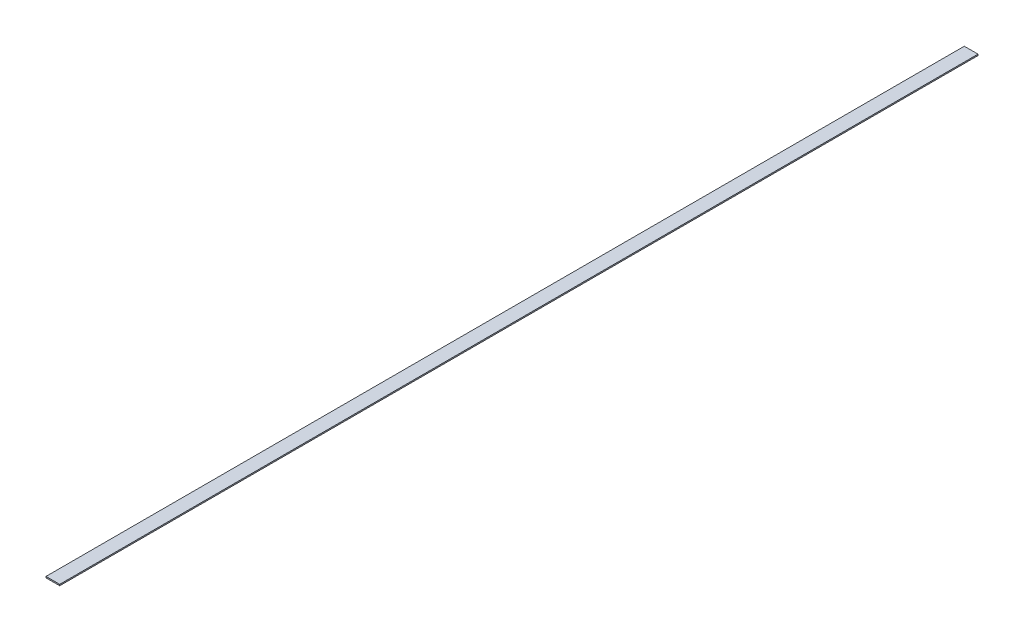
from build123d import *

# Parameters (mm, degrees)
SKETCH1_W           = 50.8
SKETCH1_H           = 4.7625
BOSS_EXTRUDE1_DEPTH = 3403.6


with BuildPart() as part:
    # Sketch1 → Boss-Extrude1 (new body)
    with BuildSketch(Plane.XY):
        with Locations((-19.015232349, 27.027852922)):
            Rectangle(SKETCH1_W, SKETCH1_H)
    extrude(amount=BOSS_EXTRUDE1_DEPTH)


solid = part.part
